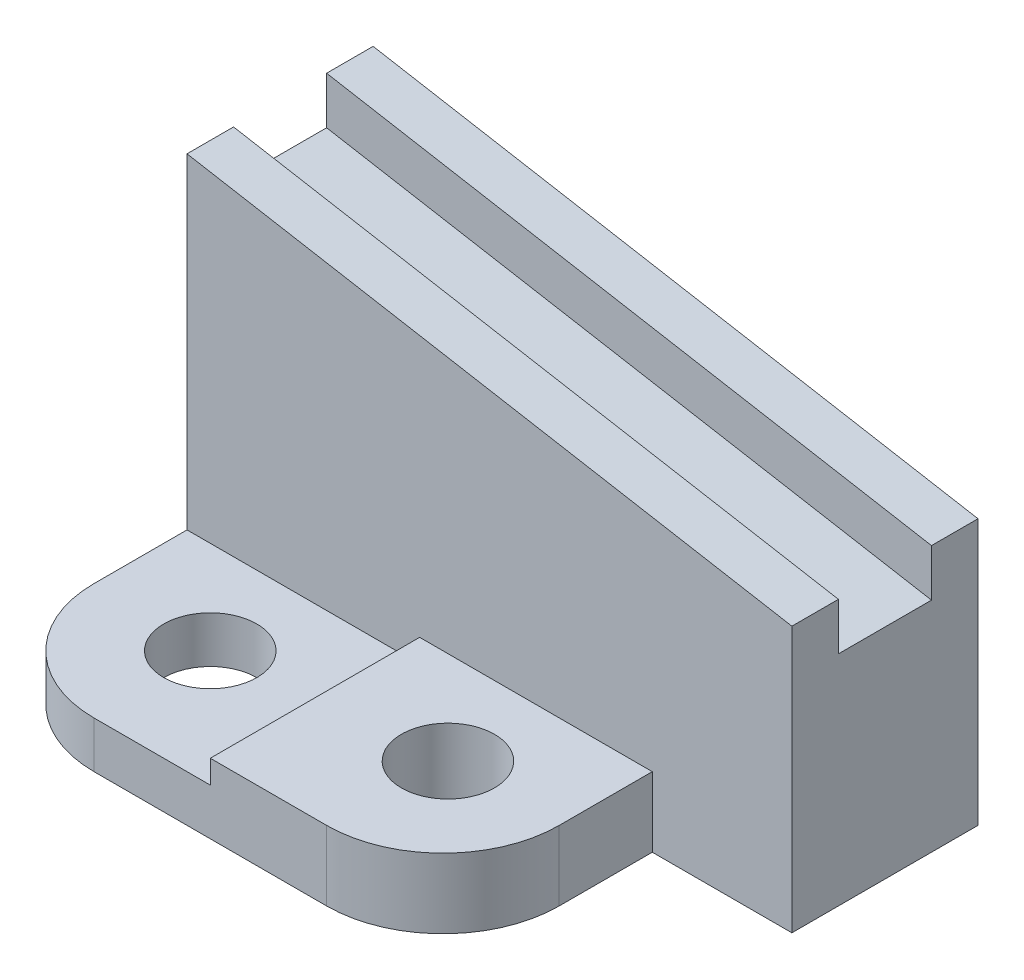
from build123d import *

# Parameters (mm, degrees)
RESSALTO_EXTRUS_O1_DEPTH = 40
ESBO_O4_W                = 171.630568717
ESBO_O4_H                = 20
CORTE_EXTRUS_O3_DEPTH    = 10
ESBO_O5_W                = 100
ESBO_O5_H                = 15
RESSALTO_EXTRUS_O2_DEPTH = 45
FILETE6_R                = 25
FILETE7_R                = 25
ESBO_O7_R                = 10
CORTE_EXTRUS_O4_DEPTH    = 132.657158163
ESBO_O8_W                = 50
ESBO_O8_H                = 45
CORTE_EXTRUS_O5_DEPTH    = 5


with BuildPart() as part:
    # Esboço1 → Ressalto-extrusão1 (new body)
    with BuildSketch(Plane.XY):
        Polygon((-53.29532416, 9.300830565), (76.70467584, 9.300830565), (76.70467584, 66.378323073), (-53.29532416, 89.300830565), align=None)
    extrude(amount=RESSALTO_EXTRUS_O1_DEPTH)

    # Esboço4 → Corte-extrusão3 (cut)
    with BuildSketch(Plane(origin=(13.664290772, 77.494043834, 0), x_dir=(0.9848077530122075, -0.17364817766693377, 0), z_dir=(0.1736481776669338, 0.9848077530122076, 0))):
        with Locations((8.431345703, -20)):
            Rectangle(ESBO_O4_W, ESBO_O4_H)
    extrude(amount=-CORTE_EXTRUS_O3_DEPTH, mode=Mode.SUBTRACT)

    # Esboço5 → Ressalto-extrusão2 (add)
    with BuildSketch(Plane.XY.offset(40)):
        with Locations((-3.29532416, 16.800830565)):
            Rectangle(ESBO_O5_W, ESBO_O5_H)
    extrude(amount=RESSALTO_EXTRUS_O2_DEPTH)

    # Filete6
    filete6_edges = [part.edges().sort_by_distance(p)[0] for p in [
        (-53.29532416, 16.800830565, 85),
    ]]
    fillet(filete6_edges, radius=FILETE6_R)

    # Filete7
    filete7_edges = [part.edges().sort_by_distance(p)[0] for p in [
        (46.70467584, 16.800830565, 85),
    ]]
    fillet(filete7_edges, radius=FILETE7_R)

    # Esboço7 → Corte-extrusão4 (cut, through all)
    with BuildSketch(Plane(origin=(0, 24.300830565, 0), x_dir=(1, 0, 0), z_dir=(0, 1, 0))):
        with Locations((-28.29532416, -60)):
            Circle(ESBO_O7_R)
        with Locations((22.777677051, -60)):
            Circle(ESBO_O7_R)
    extrude(amount=-CORTE_EXTRUS_O4_DEPTH, mode=Mode.SUBTRACT)

    # Esboço8 → Corte-extrusão5 (cut)
    with BuildSketch(Plane(origin=(0, 24.300830565, 0), x_dir=(1, 0, 0), z_dir=(0, 1, 0))):
        with Locations((-28.29532416, -62.5)):
            Rectangle(ESBO_O8_W, ESBO_O8_H)
    extrude(amount=-CORTE_EXTRUS_O5_DEPTH, mode=Mode.SUBTRACT)


solid = part.part
